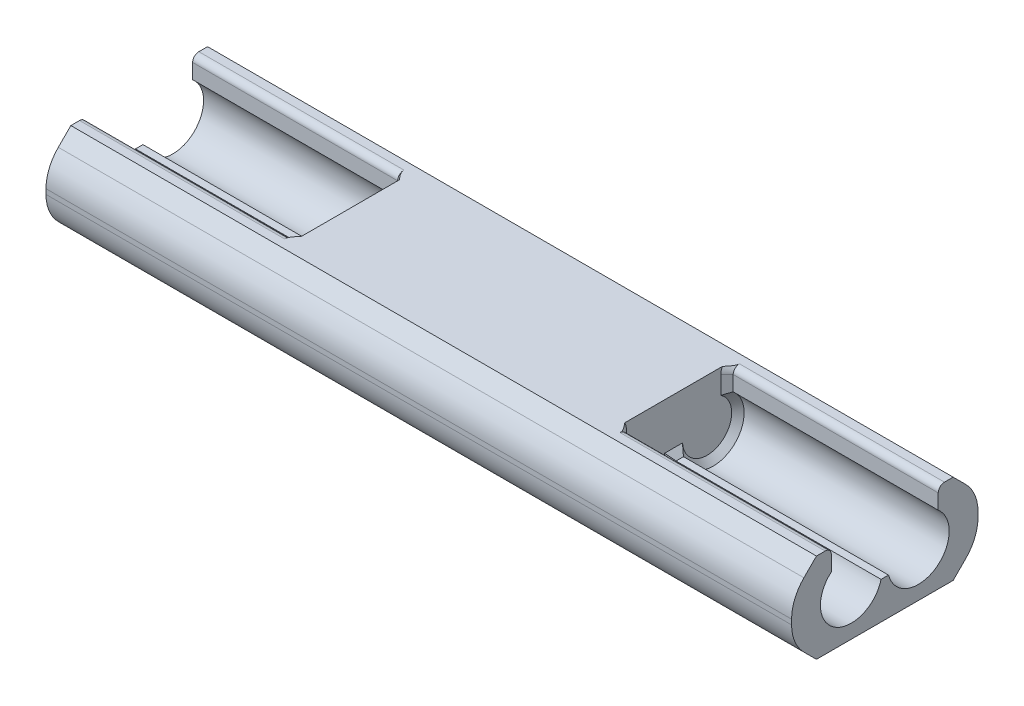
from build123d import *

# Parameters (mm, degrees)
BOSS_EXTRUDE1_DEPTH = 19.05
CUT_EXTRUDE1_DEPTH  = 10.795
FILLET1_R           = 0.3175
CHAMFER1_SIZE       = 0.3175


with BuildPart() as part:
    # Sketch1 → Boss-Extrude1 (new body)
    with BuildSketch(Plane(origin=(0, 0, 0), x_dir=(0, 0, -1), z_dir=(1, 0, 0))):
        with BuildLine():
            Line((3.4925, -2.286), (-3.4925, -2.286))
            Line((-3.4925, -2.286), (-4.133882072, -1.644617928))
            ThreePointArc((-4.133882072, -1.644617928), (-4.599127523, -0.948328904), (-4.7625, -0.127))
            Line((-4.7625, -0.127), (-4.7625, 0.127))
            ThreePointArc((-4.7625, 0.127), (-4.599127523, 0.948328904), (-4.133882072, 1.644617928))
            Line((-4.133882072, 1.644617928), (-3.4925, 2.286))
            Line((-3.4925, 2.286), (3.4925, 2.286))
            Line((3.4925, 2.286), (4.133882072, 1.644617928))
            ThreePointArc((4.133882072, 1.644617928), (4.599127523, 0.948328904), (4.7625, 0.127))
            Line((4.7625, 0.127), (4.7625, -0.127))
            ThreePointArc((4.7625, -0.127), (4.599127523, -0.948328904), (4.133882072, -1.644617928))
            Line((4.133882072, -1.644617928), (3.4925, -2.286))
        make_face()
    extrude(amount=BOSS_EXTRUDE1_DEPTH)

    # Sketch2 → Cut-Extrude1 (cut)
    with BuildSketch(Plane(origin=(19.05, 0, 0), x_dir=(0, 0, -1), z_dir=(1, 0, 0))):
        with BuildLine():
            ThreePointArc((-0.139499975, 0), (-1.051014863, 1.428430101), (-2.7305, 1.203482064))
            Line((-2.7305, 1.203482064), (-0.1905, -0.397553869))
            ThreePointArc((-0.1905, -0.397553869), (-0.15230201, -0.200405889), (-0.139499975, 0))
        make_face()
        with BuildLine():
            Line((-0.1905, -0.397553869), (-2.7305, 1.203482064))
            ThreePointArc((-2.7305, 1.203482064), (-2.554348209, -1.332396361), (-0.1905, -0.397553869))
        make_face()
        with BuildLine():
            Line((-2.7305, 2.286), (-2.7305, 1.203482064))
            ThreePointArc((-2.7305, 1.203482064), (-1.051014863, 1.428430101), (-0.139499975, 0))
            ThreePointArc((-0.139499975, 0), (-0.15230201, -0.200405889), (-0.1905, -0.397553869))
            Line((-0.1905, -0.397553869), (0.1905, -0.397553869))
            ThreePointArc((0.1905, -0.397553869), (0.874651791, 1.332396361), (2.7305, 1.203482064))
            Line((2.7305, 1.203482064), (2.7305, 2.286))
            Line((2.7305, 2.286), (-2.7305, 2.286))
        make_face()
        with BuildLine():
            ThreePointArc((2.7305, 1.203482064), (0.874651791, 1.332396361), (0.1905, -0.397553869))
            Line((0.1905, -0.397553869), (2.7305, 1.203482064))
        make_face()
        with BuildLine():
            Line((2.7305, 1.203482064), (0.1905, -0.397553869))
            ThreePointArc((0.1905, -0.397553869), (1.914905889, -1.56219799), (3.289500025, 0))
            ThreePointArc((3.289500025, 0), (3.142930101, 0.663485137), (2.7305, 1.203482064))
        make_face()
    extrude(amount=-CUT_EXTRUDE1_DEPTH, mode=Mode.SUBTRACT)

    # Fillet1
    fillet1_edges = [part.edges().sort_by_distance(p)[0] for p in [
        (13.6525, 2.286, 2.7305),
        (13.6525, 2.286, -2.7305),
    ]]
    fillet(fillet1_edges, radius=FILLET1_R)

    # Chamfer1
    chamfer1_edges = [part.edges().sort_by_distance(p)[0] for p in [
        (8.255, -0.397553869, 0),
    ]]
    chamfer(chamfer1_edges, length=CHAMFER1_SIZE)
    chamfer1_2_edges = [part.edges().sort_by_distance(p)[0] for p in [
        (8.255, 2.193006403, 2.823493597),
        (8.255, 1.585991032, 2.7305),
    ]]
    chamfer(chamfer1_2_edges, length=CHAMFER1_SIZE)
    chamfer1_3_edges = [part.edges().sort_by_distance(p)[0] for p in [
        (8.255, 1.585991032, -2.7305),
        (8.255, 2.193006403, -2.823493597),
    ]]
    chamfer(chamfer1_3_edges, length=CHAMFER1_SIZE)
    chamfer1_4_edges = [part.edges().sort_by_distance(p)[0] for p in [
        (8.255, -1.332396361, -2.554348209),
    ]]
    chamfer(chamfer1_4_edges, length=CHAMFER1_SIZE - 0.0001)  # a hair under: the kernel refuses the full size
    chamfer1_5_edges = [part.edges().sort_by_distance(p)[0] for p in [
        (8.255, -1.332396361, 2.554348209),
    ]]
    chamfer(chamfer1_5_edges, length=CHAMFER1_SIZE - 0.0001)  # a hair under: the kernel refuses the full size

    # Mirror1: part across plane


with BuildPart() as part_1:
    add(part.part)
    add(part.part.mirror(Plane(origin=(0, 0, 0), x_dir=(0, 0, 1), z_dir=(1, 0, 0))))


solid = part_1.part
